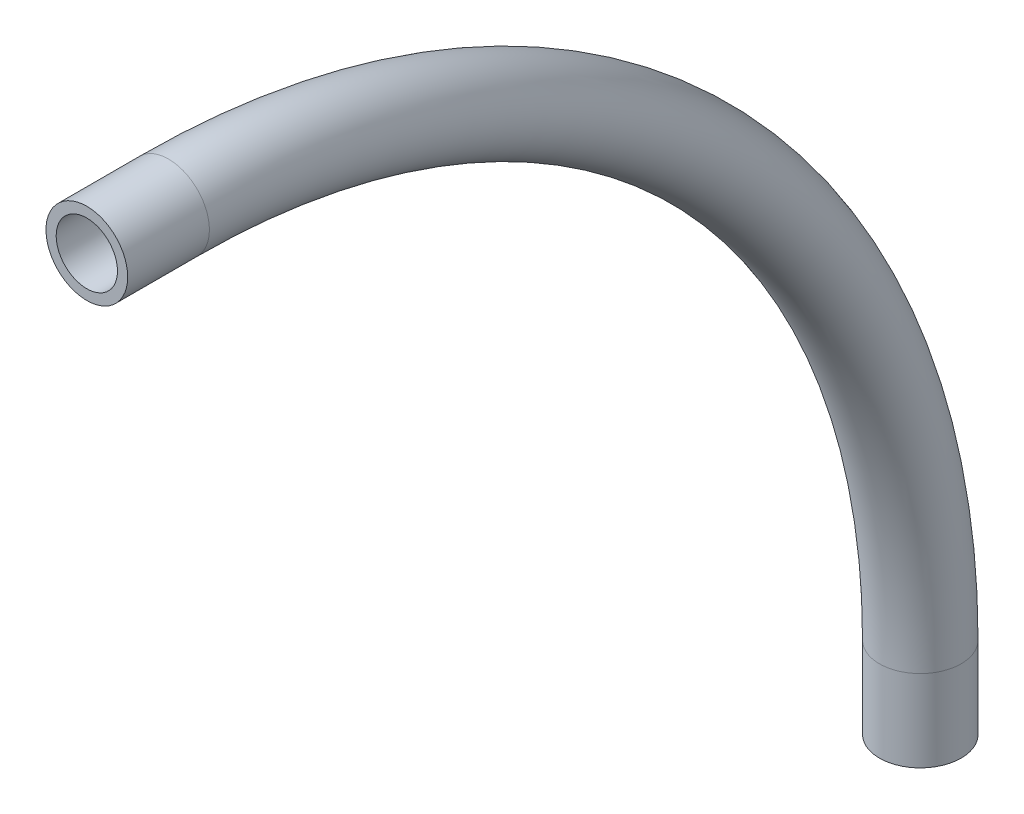
from build123d import *

# Parameters (mm, degrees)
SKETCH1_R   = 6.35
SKETCH1_R_2 = 4.7625


with BuildPart() as part:
    # Sweep1: sweep along a path in Sketch2
    with BuildLine(Plane(origin=(0, 0, 0), x_dir=(0, 0, -1), z_dir=(1, 0, 0))) as sweep1_path:
        Line((0, 0), (12.7, 0))
        ThreePointArc((12.7, 0), (95.318356314, -34.221643686), (129.54, -116.84))
        Line((129.54, -116.84), (129.54, -129.54))
    # Sketch1 → Sweep1 (sweep)
    with BuildSketch(Plane.XY):
        Circle(SKETCH1_R)
        Circle(SKETCH1_R_2, mode=Mode.SUBTRACT)
    sweep(path=sweep1_path.line)


solid = part.part
